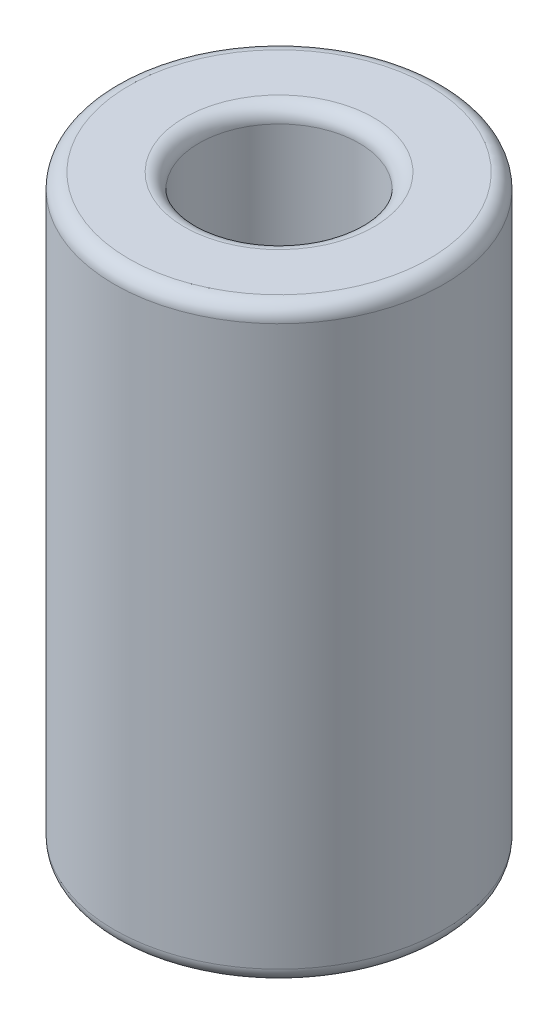
from build123d import *

# Parameters (mm, degrees)
SKETCH1_R           = 4.445
SKETCH1_R_2         = 2.159
BOSS_EXTRUDE1_DEPTH = 15.875
FILLET1_R           = 0.396875


with BuildPart() as part:
    # Sketch1 → Boss-Extrude1 (new body)
    with BuildSketch(Plane(origin=(0, 0, 0), x_dir=(1, 0, 0), z_dir=(0, 1, 0))):
        Circle(SKETCH1_R)
        Circle(SKETCH1_R_2, mode=Mode.SUBTRACT)
    extrude(amount=BOSS_EXTRUDE1_DEPTH)

    # Fillet1
    fillet1_edges = [part.edges().sort_by_distance(p)[0] for p in [
        (-2.159, 0, 0),
        (-4.445, 0, 0),
        (-2.159, 15.875, 0),
        (-4.445, 15.875, 0),
    ]]
    fillet(fillet1_edges, radius=FILLET1_R)


solid = part.part
